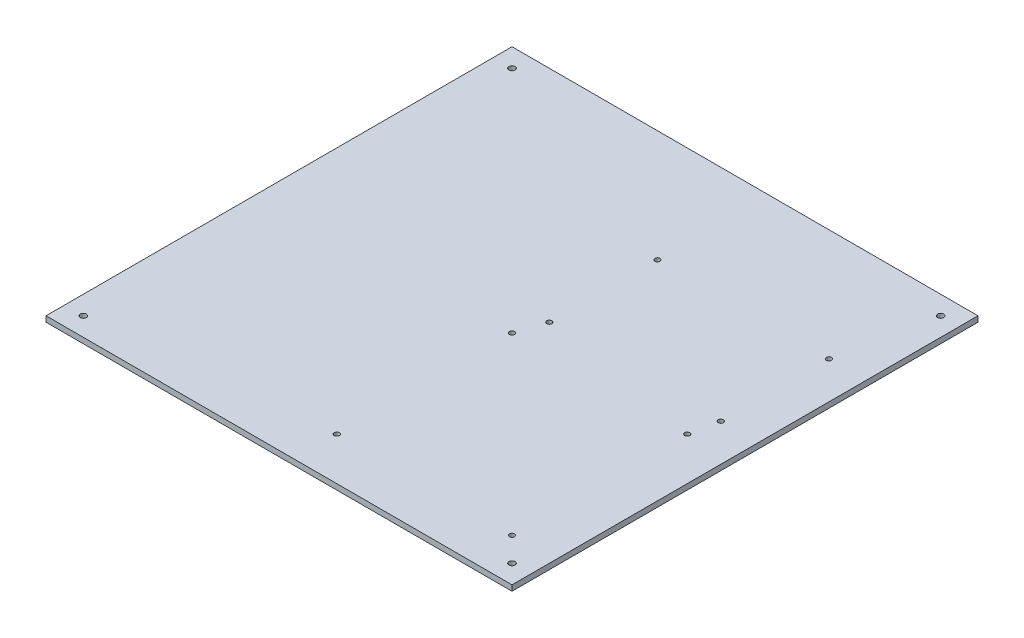
from build123d import *

# Parameters (mm, degrees)
SKETCH1_W           = 250
SKETCH1_H           = 250
SKETCH1_R           = 1.65
SKETCH1_R_2         = 1.375
BOSS_EXTRUDE1_DEPTH = 3


with BuildPart() as part:
    # Sketch1 → Boss-Extrude1 (new body)
    with BuildSketch(Plane(origin=(0, 0, 0), x_dir=(1, 0, 0), z_dir=(0, 1, 0))):
        with Locations((0, -125)):
            Rectangle(SKETCH1_W, SKETCH1_H)
        with Locations((-115, -240)):
            Circle(SKETCH1_R, mode=Mode.SUBTRACT)
        with Locations((115, -240)):
            Circle(SKETCH1_R, mode=Mode.SUBTRACT)
        with Locations((-115, -10)):
            Circle(SKETCH1_R, mode=Mode.SUBTRACT)
        with Locations((115, -10)):
            Circle(SKETCH1_R, mode=Mode.SUBTRACT)
        with Locations((13, -60)):
            Circle(SKETCH1_R_2, mode=Mode.SUBTRACT)
        with Locations((13, -118)):
            Circle(SKETCH1_R_2, mode=Mode.SUBTRACT)
        with Locations((105, -118)):
            Circle(SKETCH1_R_2, mode=Mode.SUBTRACT)
        with Locations((105, -60)):
            Circle(SKETCH1_R_2, mode=Mode.SUBTRACT)
        with Locations((8, -133)):
            Circle(SKETCH1_R_2, mode=Mode.SUBTRACT)
        with Locations((102, -133)):
            Circle(SKETCH1_R_2, mode=Mode.SUBTRACT)
        with Locations((102, -227)):
            Circle(SKETCH1_R_2, mode=Mode.SUBTRACT)
        with Locations((8, -227)):
            Circle(SKETCH1_R_2, mode=Mode.SUBTRACT)
    extrude(amount=BOSS_EXTRUDE1_DEPTH)


solid = part.part
